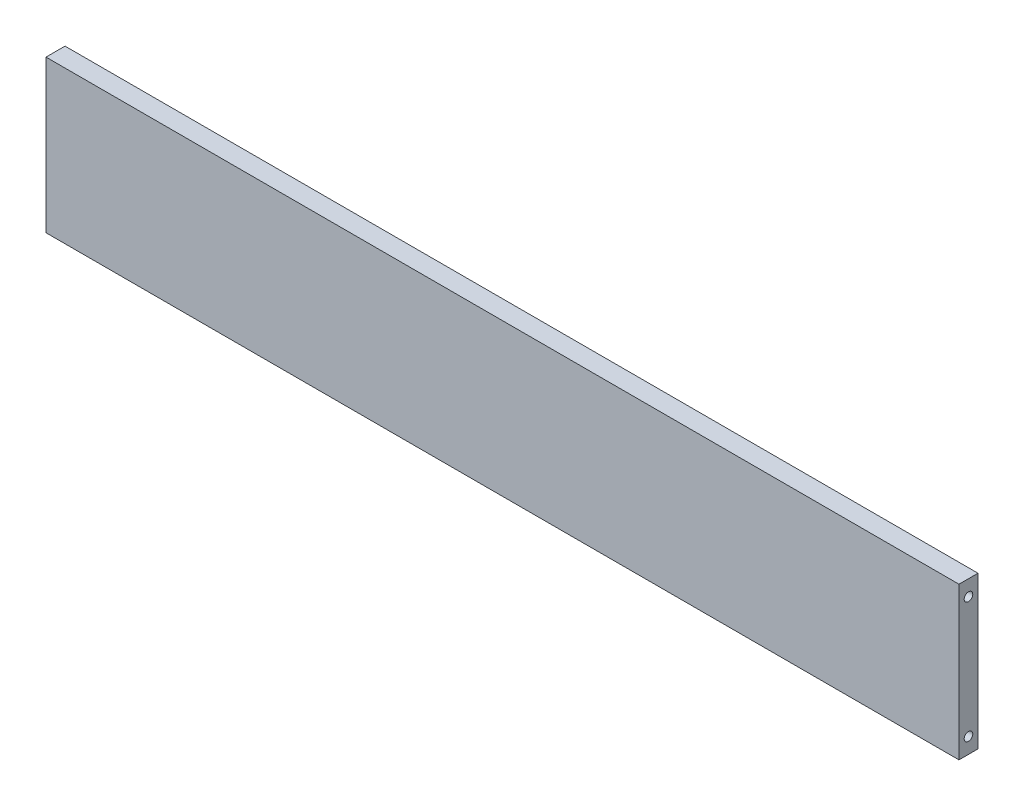
from build123d import *

# Parameters (mm, degrees)
SKETCH1_W           = 384
SKETCH1_H           = 64
BOSS_EXTRUDE1_DEPTH = 8
CUT_EXTRUDE1_REACH  = 387.414
SKETCH2_R           = 1.8


with BuildPart() as part:
    # Sketch1 → Boss-Extrude1 (new body)
    with BuildSketch(Plane.XY):
        Rectangle(SKETCH1_W, SKETCH1_H)
    extrude(amount=BOSS_EXTRUDE1_DEPTH)

    # Sketch2 → Cut-Extrude1 (cut, up to next)
    with BuildSketch(Plane.ZY.offset(192), mode=Mode.PRIVATE) as cut_extrude1_sk1:
        with Locations((4, 25.445)):
            Circle(SKETCH2_R)
    cut_extrude1_tool1 = extrude(cut_extrude1_sk1.sketch, amount=-CUT_EXTRUDE1_REACH, mode=Mode.PRIVATE) & part.part
    # Sketch2 → Cut-Extrude1 (cut, up to next)
    with BuildSketch(Plane.ZY.offset(192), mode=Mode.PRIVATE) as cut_extrude1_sk2:
        with Locations((4, -25.445)):
            Circle(SKETCH2_R)
    cut_extrude1_tool2 = extrude(cut_extrude1_sk2.sketch, amount=-CUT_EXTRUDE1_REACH, mode=Mode.PRIVATE) & part.part
    add(cut_extrude1_tool1.solids().sort_by_distance((-192, 25.445, 4))[0], mode=Mode.SUBTRACT)
    add(cut_extrude1_tool2.solids().sort_by_distance((-192, -25.445, 4))[0], mode=Mode.SUBTRACT)


solid = part.part
